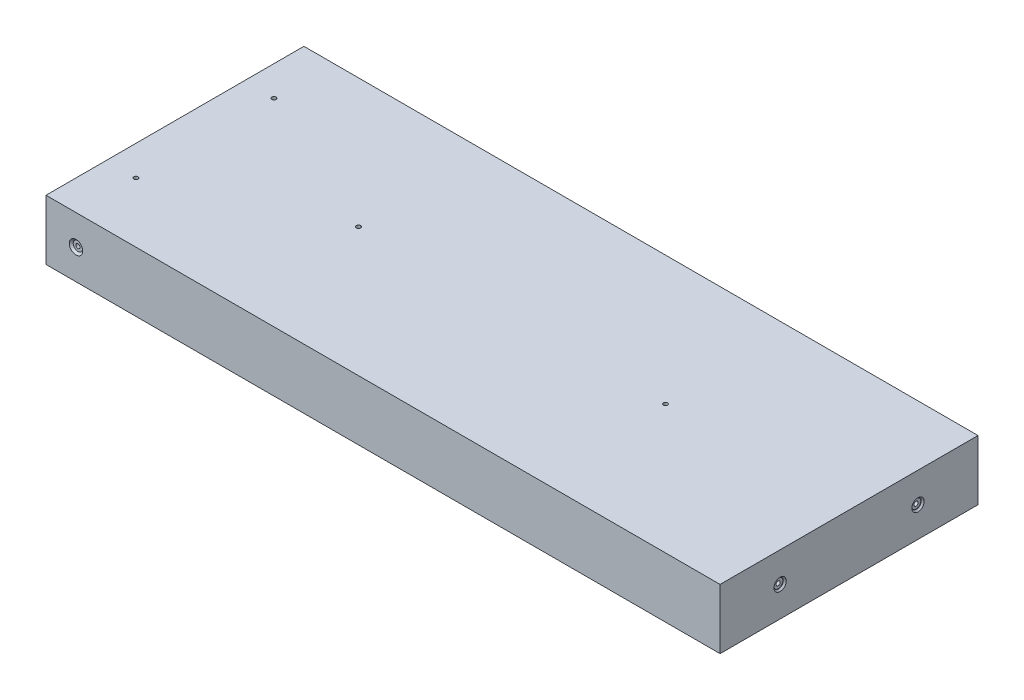
from build123d import *

# Parameters (mm, degrees)
SKETCH1_W                                   = 285.4
SKETCH1_H                                   = 109.2
BOSS_EXTRUDE1_DEPTH                         = 25.4
CBORE_FOR_0_BINDING_HEAD_MACHINE_SC_2_COUNT = 2
CBORE_FOR_0_BINDING_HEAD_MACHINE_SC_2_PITCH = 58.4
CBORE_FOR_0_BINDING_HEAD_MACHINE_SC_3_COUNT = 2
CBORE_FOR_0_BINDING_HEAD_MACHINE_SC_3_PITCH = 130
CBORE_FOR_0_BINDING_HEAD_MACHINE_SC_4_COUNT = 2
CBORE_FOR_0_BINDING_HEAD_MACHINE_SC_4_PITCH = 58.4


with BuildPart() as part:
    # Sketch1 → Boss-Extrude1 (new body)
    with BuildSketch(Plane(origin=(0, 0, 0), x_dir=(1, 0, 0), z_dir=(0, 1, 0))):
        Rectangle(SKETCH1_W, SKETCH1_H)
    extrude(amount=BOSS_EXTRUDE1_DEPTH)

    # Sketch3 → CBORE for #0 Binding Head Machine Screw1 (revolve, cut)
    with BuildSketch(Plane(origin=(-130, 12.7, 54.6), x_dir=(0, -1, 0), z_dir=(1, 0, 0))):
        Polygon((0, 0), (0, 30.53416509), (0.889, 30), (0.889, 0.8128), (1.98501, 0.8128), (1.98501, 0.87249), (2.8575, 0), align=None)
    cbore_for_0_binding_head_machine_screw1 = revolve(axis=Axis((-130, 12.7, 60.95), (0, 0, -1)), mode=Mode.SUBTRACT)

    # Mirror1: CBORE for #0 Binding Head Machine Screw1 across plane
    add(cbore_for_0_binding_head_machine_screw1.mirror(Plane.XY), mode=Mode.SUBTRACT)

    # Sketch5 → CBORE for #0 Binding Head Machine Screw2 (revolve, cut)
    with BuildSketch(Plane(origin=(142.7, 12.7, 29.1995), x_dir=(0, 0, -1), z_dir=(0, 1, 0))):
        Polygon((0, 0), (0, 30.53416509), (0.889, 30), (0.889, 0.8128), (1.98501, 0.8128), (1.98501, 0.635), (2.62001, 0), align=None)
    cbore_for_0_binding_head_machine_screw2 = revolve(axis=Axis((149.05, 12.7, 29.1995), (-1, 0, 0)), mode=Mode.SUBTRACT)

    # CBORE for _0 Binding Head Machine Sc 2: CBORE for #0 Binding Head Machine Screw2 ×2
    with Locations(*[(0, 0, -i * CBORE_FOR_0_BINDING_HEAD_MACHINE_SC_2_PITCH) for i in range(1, CBORE_FOR_0_BINDING_HEAD_MACHINE_SC_2_COUNT)]):
        add(cbore_for_0_binding_head_machine_screw2, mode=Mode.SUBTRACT)

    # Sketch9 → CBORE for #0 Binding Head Machine Screw4 (revolve, cut)
    with BuildSketch(Plane(origin=(-65, 0, 0), x_dir=(0, 0, -1), z_dir=(1, 0, 0))):
        Polygon((0, 0), (0, 30.53416509), (0.889, 30), (0.889, 0.8128), (1.98501, 0.8128), (1.98501, 0.87249), (2.8575, 0), align=None)
    cbore_for_0_binding_head_machine_screw4 = revolve(axis=Axis((-65, -6.35, 0), (0, 1, 0)), mode=Mode.SUBTRACT)

    # CBORE for _0 Binding Head Machine Sc 3: CBORE for #0 Binding Head Machine Screw4 ×2
    with Locations(*[(i * CBORE_FOR_0_BINDING_HEAD_MACHINE_SC_3_PITCH, 0, 0) for i in range(1, CBORE_FOR_0_BINDING_HEAD_MACHINE_SC_3_COUNT)]):
        add(cbore_for_0_binding_head_machine_screw4, mode=Mode.SUBTRACT)

    # Sketch13 → CBORE for #0 Binding Head Machine Screw6 (revolve, cut)
    with BuildSketch(Plane(origin=(-130, 0, -29.2), x_dir=(0, 0, -1), z_dir=(1, 0, 0))):
        Polygon((0, 0), (0, 25.4), (0.889, 25.4), (0.889, 0.8128), (1.98501, 0.8128), (1.98501, 0.87249), (2.8575, 0), align=None)
    cbore_for_0_binding_head_machine_screw6 = revolve(axis=Axis((-130, -6.35, -29.2), (0, 1, 0)), mode=Mode.SUBTRACT)

    # CBORE for _0 Binding Head Machine Sc 4: CBORE for #0 Binding Head Machine Screw6 ×2
    with Locations(*[(0, 0, i * CBORE_FOR_0_BINDING_HEAD_MACHINE_SC_4_PITCH) for i in range(1, CBORE_FOR_0_BINDING_HEAD_MACHINE_SC_4_COUNT)]):
        add(cbore_for_0_binding_head_machine_screw6, mode=Mode.SUBTRACT)


solid = part.part
